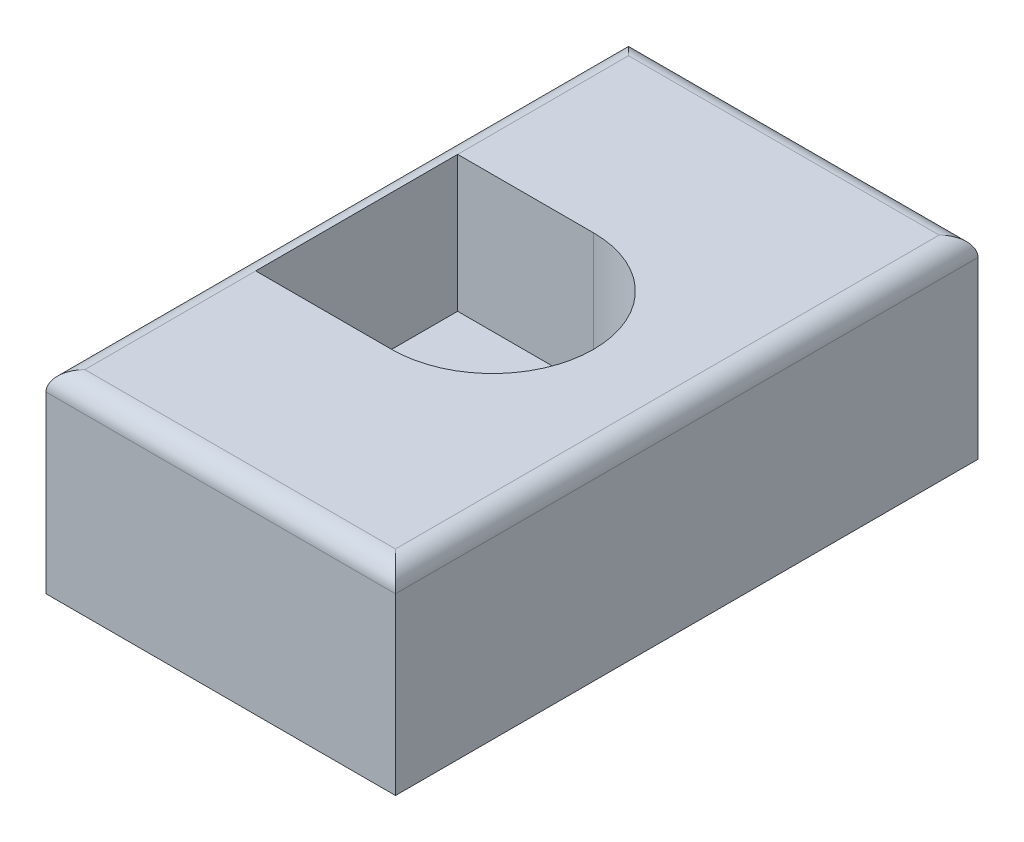
from build123d import *

# Parameters (mm, degrees)
SKETCH2_W          = 20
SKETCH2_H          = 30
EXTRUDE1_DEPTH     = 10
CUT_EXTRUDE1_DEPTH = 7
SKETCH4_R          = 2.65
CUT_EXTRUDE2_DEPTH = 17
SKETCH7_W          = 2
SKETCH7_H          = 10
EXTRUDE2_DEPTH     = 30
FILLET1_R          = 1


with BuildPart() as part:
    # Sketch2 → Extrude1 (new body)
    with BuildSketch(Plane(origin=(0, 15, 0), x_dir=(1, 0, 0), z_dir=(0, 1, 0))):
        with Locations((0, 313.863465254)):
            Rectangle(SKETCH2_W, SKETCH2_H)
    extrude(amount=EXTRUDE1_DEPTH)

    # Sketch3 → Cut-Extrude1 (cut)
    with BuildSketch(Plane(origin=(0, 25, 0), x_dir=(1, 0, 0), z_dir=(0, 1, 0))):
        with BuildLine():
            Line((0, 319.063465254), (-7, 319.063465254))
            Line((-7, 319.063465254), (-7, 308.663465254))
            Line((-7, 308.663465254), (0, 308.663465254))
            ThreePointArc((0, 308.663465254), (5.2, 313.863465254), (0, 319.063465254))
        make_face()
    extrude(amount=-CUT_EXTRUDE1_DEPTH, mode=Mode.SUBTRACT)

    # Sketch4 → Cut-Extrude2 (cut)
    with BuildSketch(Plane(origin=(0, 18, 0), x_dir=(1, 0, 0), z_dir=(0, 1, 0))):
        with Locations(Location((0, 313.863465254, 0), (0, 0, 270))):
            Circle(SKETCH4_R)
    extrude(amount=-CUT_EXTRUDE2_DEPTH, mode=Mode.SUBTRACT)

    # Sketch7 → Extrude2 (cut)
    with BuildSketch(Plane.XY.offset(-298.863465254)):
        with Locations((-9, 20)):
            Rectangle(SKETCH7_W, SKETCH7_H)
    extrude(amount=-EXTRUDE2_DEPTH, mode=Mode.SUBTRACT)

    # Fillet1
    fillet1_edges = [part.edges().sort_by_distance(p)[0] for p in [
        (1, 25, -298.863465254),
        (-8, 25, -313.863465254),
        (10, 25, -313.863465254),
        (1, 25, -328.863465254),
    ]]
    fillet(fillet1_edges, radius=FILLET1_R - 0.0001)  # a hair under: the kernel refuses the full size


solid = part.part
